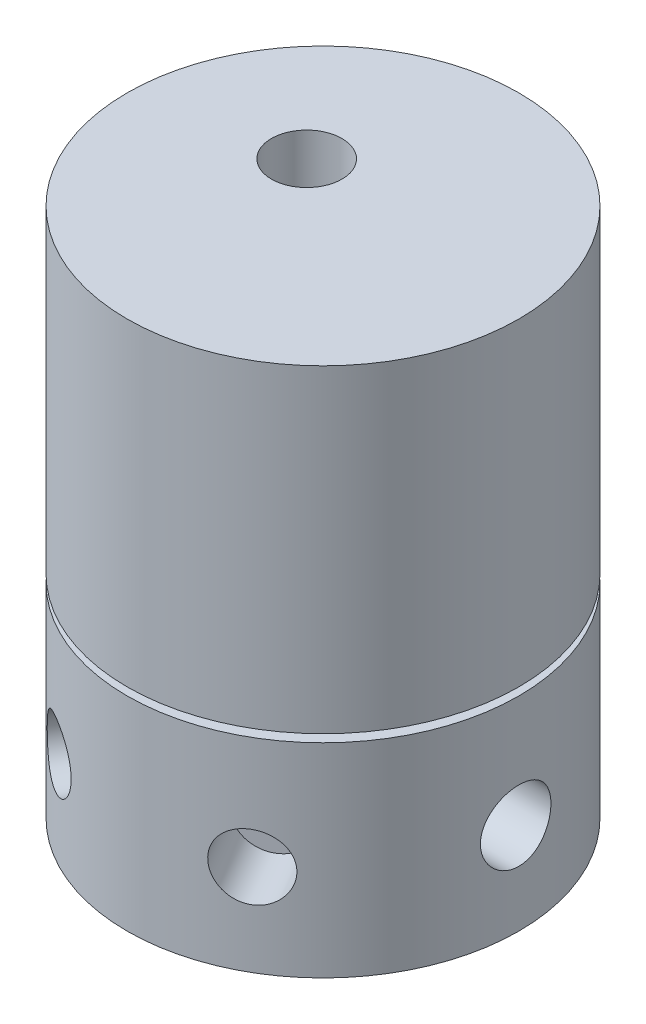
from build123d import *

# Parameters (mm, degrees)
SKETCH1_R           = 38.1
BOSS_EXTRUDE1_DEPTH = 39.624
SKETCH2_R           = 22.606
BOSS_EXTRUDE2_DEPTH = 12.7
SKETCH3_R           = 38.1
BOSS_EXTRUDE3_DEPTH = 61.976
CUT_EXTRUDE1_START  = 25.4
SKETCH4_R           = 6.858
CUT_EXTRUDE1_DEPTH  = 12.7
CUT_EXTRUDE2_START  = -25.4
SKETCH5_R           = 9.525
CUT_EXTRUDE2_DEPTH  = 12.7
SKETCH7_R           = 6.35
CUT_EXTRUDE3_DEPTH  = 12.7
SKETCH8_R           = 6.35
CUT_EXTRUDE5_DEPTH  = 12.7
SKETCH9_R           = 6.858
CUT_EXTRUDE6_DEPTH  = 12.7


with BuildPart() as part:
    # Sketch1 → Boss-Extrude1 (new body)
    with BuildSketch(Plane(origin=(0, 0, 0), x_dir=(1, 0, 0), z_dir=(0, 1, 0))):
        Circle(SKETCH1_R)
    extrude(amount=BOSS_EXTRUDE1_DEPTH)

    # Sketch2 → Boss-Extrude2 (add)
    with BuildSketch(Plane(origin=(0, 39.624, 0), x_dir=(1, 0, 0), z_dir=(0, 1, 0))):
        Circle(SKETCH2_R)
    extrude(amount=BOSS_EXTRUDE2_DEPTH)

    # Sketch3 → Boss-Extrude3 (add)
    with BuildSketch(Plane(origin=(0, 41.148, 0), x_dir=(1, 0, 0), z_dir=(0, 1, 0))):
        Circle(SKETCH3_R)
    extrude(amount=BOSS_EXTRUDE3_DEPTH)

    # Sketch4 → Cut-Extrude1 (cut)
    with BuildSketch(Plane(origin=(0, 0, 0), x_dir=(0, 0, -1), z_dir=(1, 0, 0)).offset(CUT_EXTRUDE1_START)):
        with Locations((0, 17.78)):
            Circle(SKETCH4_R)
    extrude(amount=CUT_EXTRUDE1_DEPTH, mode=Mode.SUBTRACT)

    # Sketch5 → Cut-Extrude2 (cut)
    with BuildSketch(Plane(origin=(0, 0, 0), x_dir=(0, 0, -1), z_dir=(1, 0, 0)).offset(CUT_EXTRUDE2_START)):
        with Locations((0, 17.78)):
            Circle(SKETCH5_R)
    extrude(amount=-CUT_EXTRUDE2_DEPTH, mode=Mode.SUBTRACT)

    # Sketch7 → Cut-Extrude3 (cut)
    with BuildSketch(Plane(origin=(-19.05, 0, 32.995567884), x_dir=(0.8660254037844415, 0, 0.49999999999999517), z_dir=(-0.4999999999999951, 0, 0.8660254037844414))):
        with Locations((0, 17.78)):
            Circle(SKETCH7_R)
    extrude(amount=-CUT_EXTRUDE3_DEPTH, mode=Mode.SUBTRACT)

    # Sketch8 → Cut-Extrude5 (cut)
    with BuildSketch(Plane(origin=(19.05, 0, 32.995567884), x_dir=(0.8660254037844417, 0, -0.49999999999999467), z_dir=(0.49999999999999467, 0, 0.8660254037844417))):
        with Locations((0, 17.78)):
            Circle(SKETCH8_R)
    extrude(amount=-CUT_EXTRUDE5_DEPTH, mode=Mode.SUBTRACT)

    # Sketch9 → Cut-Extrude6 (cut)
    with BuildSketch(Plane(origin=(0, 103.124, 0), x_dir=(1, 0, 0), z_dir=(0, 1, 0))):
        with Locations((-9.525, 6.35)):
            Circle(SKETCH9_R)
    extrude(amount=-CUT_EXTRUDE6_DEPTH, mode=Mode.SUBTRACT)


solid = part.part
